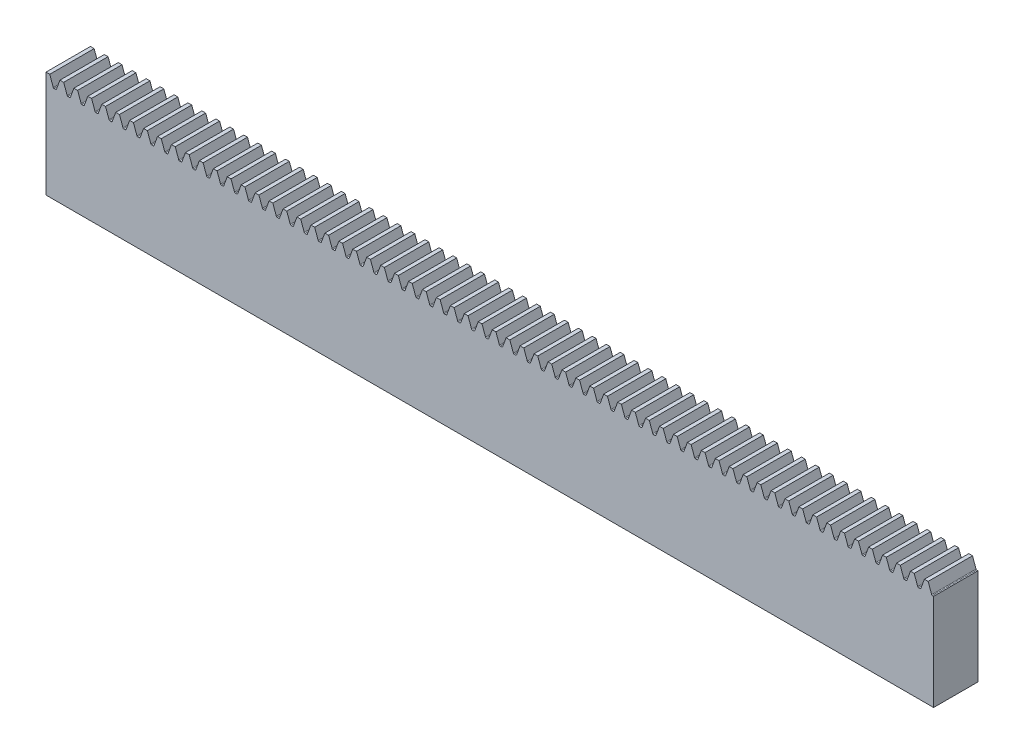
from build123d import *

# Parameters (mm, degrees)
BOSS_EXTRUDE1_DEPTH      = 50
BOSS_EXTRUDE1_DEPTH_BACK = 50
SKETCH2_W                = 5
SKETCH2_H                = 12
TOOTH_CUT_DEPTH          = 52.480578862
FILLET1_R                = 0.093496903
LPATTERN1_START          = -2.5
LPATTERN1_DEPTH          = 5


# Read off the part's stored shape, not the designer's step: LPattern1
with BuildPart() as part:
    # Sketch2 → Boss-Extrude1 (new, two sides: drawn at the far end of the back side and taken through both)
    with BuildSketch(Plane(origin=(0, 0, 0), x_dir=(0, 0, -1), z_dir=(1, 0, 0)).offset(-BOSS_EXTRUDE1_DEPTH_BACK)):
        with Locations((0, 6)):
            Rectangle(SKETCH2_W, SKETCH2_H)
    extrude(amount=BOSS_EXTRUDE1_DEPTH + BOSS_EXTRUDE1_DEPTH_BACK)

    # Tooth Cut Sketch → Tooth Cut (cut, symmetric)
    with BuildSketch(Plane.XY):
        Polygon((-49.578570234, 12), (-49.159713289, 10.8492), (-48.848056946, 10.8492), (-48.4292, 12), align=None)
    extrude(amount=TOOTH_CUT_DEPTH, both=True, mode=Mode.SUBTRACT)

    # Fillet1
    fillet1_edges = [part.edges().sort_by_distance(p)[0] for p in [
        (-48.848056946, 10.8492, 0),
        (-49.159713289, 10.8492, 0),
    ]]
    fillet(fillet1_edges, radius=FILLET1_R)

    # LPattern1 outline → LPattern1 (cut)
    with BuildSketch(Plane.XY.offset(LPATTERN1_START)):
        with BuildLine():
            ThreePointArc((-47.611304402, 10.910719079), (-47.577073673, 10.866108724), (-47.523446052, 10.8492))
            Line((-47.523446052, 10.8492), (-47.342724182, 10.8492))
            ThreePointArc((-47.342724182, 10.8492), (-47.289096561, 10.866108724), (-47.254865832, 10.910719079))
            Line((-47.254865832, 10.910719079), (-46.8584, 12))
            Line((-46.8584, 12), (-48.007770234, 12))
            Line((-48.007770234, 12), (-47.611304402, 10.910719079))
        make_face()
        with BuildLine():
            Line((50, 12), (49.381829766, 12))
            Line((49.381829766, 12), (49.778295598, 10.910719079))
            ThreePointArc((49.778295598, 10.910719079), (49.812526327, 10.866108724), (49.866153948, 10.8492))
            Line((49.866153948, 10.8492), (50, 10.8492))
            Line((50, 10.8492), (50, 12))
        make_face()
        with BuildLine():
            Line((48.9604, 12), (47.811029766, 12))
            Line((47.811029766, 12), (48.207495598, 10.910719079))
            ThreePointArc((48.207495598, 10.910719079), (48.241726327, 10.866108724), (48.295353948, 10.8492))
            Line((48.295353948, 10.8492), (48.476075818, 10.8492))
            ThreePointArc((48.476075818, 10.8492), (48.529703439, 10.866108724), (48.563934168, 10.910719079))
            Line((48.563934168, 10.910719079), (48.9604, 12))
        make_face()
        with BuildLine():
            Line((47.3896, 12), (46.240229766, 12))
            Line((46.240229766, 12), (46.636695598, 10.910719079))
            ThreePointArc((46.636695598, 10.910719079), (46.670926327, 10.866108724), (46.724553948, 10.8492))
            Line((46.724553948, 10.8492), (46.905275818, 10.8492))
            ThreePointArc((46.905275818, 10.8492), (46.958903439, 10.866108724), (46.993134168, 10.910719079))
            Line((46.993134168, 10.910719079), (47.3896, 12))
        make_face()
        with BuildLine():
            Line((45.8188, 12), (44.669429766, 12))
            Line((44.669429766, 12), (45.065895598, 10.910719079))
            ThreePointArc((45.065895598, 10.910719079), (45.100126327, 10.866108724), (45.153753948, 10.8492))
            Line((45.153753948, 10.8492), (45.334475818, 10.8492))
            ThreePointArc((45.334475818, 10.8492), (45.388103439, 10.866108724), (45.422334168, 10.910719079))
            Line((45.422334168, 10.910719079), (45.8188, 12))
        make_face()
        with BuildLine():
            Line((44.248, 12), (43.098629766, 12))
            Line((43.098629766, 12), (43.495095598, 10.910719079))
            ThreePointArc((43.495095598, 10.910719079), (43.529326327, 10.866108724), (43.582953948, 10.8492))
            Line((43.582953948, 10.8492), (43.763675818, 10.8492))
            ThreePointArc((43.763675818, 10.8492), (43.817303439, 10.866108724), (43.851534168, 10.910719079))
            Line((43.851534168, 10.910719079), (44.248, 12))
        make_face()
        with BuildLine():
            Line((42.6772, 12), (41.527829766, 12))
            Line((41.527829766, 12), (41.924295598, 10.910719079))
            ThreePointArc((41.924295598, 10.910719079), (41.958526327, 10.866108724), (42.012153948, 10.8492))
            Line((42.012153948, 10.8492), (42.192875818, 10.8492))
            ThreePointArc((42.192875818, 10.8492), (42.246503439, 10.866108724), (42.280734168, 10.910719079))
            Line((42.280734168, 10.910719079), (42.6772, 12))
        make_face()
        with BuildLine():
            Line((41.1064, 12), (39.957029766, 12))
            Line((39.957029766, 12), (40.353495598, 10.910719079))
            ThreePointArc((40.353495598, 10.910719079), (40.387726327, 10.866108724), (40.441353948, 10.8492))
            Line((40.441353948, 10.8492), (40.622075818, 10.8492))
            ThreePointArc((40.622075818, 10.8492), (40.675703439, 10.866108724), (40.709934168, 10.910719079))
            Line((40.709934168, 10.910719079), (41.1064, 12))
        make_face()
        with BuildLine():
            Line((39.5356, 12), (38.386229766, 12))
            Line((38.386229766, 12), (38.782695598, 10.910719079))
            ThreePointArc((38.782695598, 10.910719079), (38.816926327, 10.866108724), (38.870553948, 10.8492))
            Line((38.870553948, 10.8492), (39.051275818, 10.8492))
            ThreePointArc((39.051275818, 10.8492), (39.104903439, 10.866108724), (39.139134168, 10.910719079))
            Line((39.139134168, 10.910719079), (39.5356, 12))
        make_face()
        with BuildLine():
            Line((37.9648, 12), (36.815429766, 12))
            Line((36.815429766, 12), (37.211895598, 10.910719079))
            ThreePointArc((37.211895598, 10.910719079), (37.246126327, 10.866108724), (37.299753948, 10.8492))
            Line((37.299753948, 10.8492), (37.480475818, 10.8492))
            ThreePointArc((37.480475818, 10.8492), (37.534103439, 10.866108724), (37.568334168, 10.910719079))
            Line((37.568334168, 10.910719079), (37.9648, 12))
        make_face()
        with BuildLine():
            Line((36.394, 12), (35.244629766, 12))
            Line((35.244629766, 12), (35.641095598, 10.910719079))
            ThreePointArc((35.641095598, 10.910719079), (35.675326327, 10.866108724), (35.728953948, 10.8492))
            Line((35.728953948, 10.8492), (35.909675818, 10.8492))
            ThreePointArc((35.909675818, 10.8492), (35.963303439, 10.866108724), (35.997534168, 10.910719079))
            Line((35.997534168, 10.910719079), (36.394, 12))
        make_face()
        with BuildLine():
            Line((34.8232, 12), (33.673829766, 12))
            Line((33.673829766, 12), (34.070295598, 10.910719079))
            ThreePointArc((34.070295598, 10.910719079), (34.104526327, 10.866108724), (34.158153948, 10.8492))
            Line((34.158153948, 10.8492), (34.338875818, 10.8492))
            ThreePointArc((34.338875818, 10.8492), (34.392503439, 10.866108724), (34.426734168, 10.910719079))
            Line((34.426734168, 10.910719079), (34.8232, 12))
        make_face()
        with BuildLine():
            Line((33.2524, 12), (32.103029766, 12))
            Line((32.103029766, 12), (32.499495598, 10.910719079))
            ThreePointArc((32.499495598, 10.910719079), (32.533726327, 10.866108724), (32.587353948, 10.8492))
            Line((32.587353948, 10.8492), (32.768075818, 10.8492))
            ThreePointArc((32.768075818, 10.8492), (32.821703439, 10.866108724), (32.855934168, 10.910719079))
            Line((32.855934168, 10.910719079), (33.2524, 12))
        make_face()
        with BuildLine():
            Line((31.6816, 12), (30.532229766, 12))
            Line((30.532229766, 12), (30.928695598, 10.910719079))
            ThreePointArc((30.928695598, 10.910719079), (30.962926327, 10.866108724), (31.016553948, 10.8492))
            Line((31.016553948, 10.8492), (31.197275818, 10.8492))
            ThreePointArc((31.197275818, 10.8492), (31.250903439, 10.866108724), (31.285134168, 10.910719079))
            Line((31.285134168, 10.910719079), (31.6816, 12))
        make_face()
        with BuildLine():
            Line((30.1108, 12), (28.961429766, 12))
            Line((28.961429766, 12), (29.357895598, 10.910719079))
            ThreePointArc((29.357895598, 10.910719079), (29.392126327, 10.866108724), (29.445753948, 10.8492))
            Line((29.445753948, 10.8492), (29.626475818, 10.8492))
            ThreePointArc((29.626475818, 10.8492), (29.680103439, 10.866108724), (29.714334168, 10.910719079))
            Line((29.714334168, 10.910719079), (30.1108, 12))
        make_face()
        with BuildLine():
            Line((28.54, 12), (27.390629766, 12))
            Line((27.390629766, 12), (27.787095598, 10.910719079))
            ThreePointArc((27.787095598, 10.910719079), (27.821326327, 10.866108724), (27.874953948, 10.8492))
            Line((27.874953948, 10.8492), (28.055675818, 10.8492))
            ThreePointArc((28.055675818, 10.8492), (28.109303439, 10.866108724), (28.143534168, 10.910719079))
            Line((28.143534168, 10.910719079), (28.54, 12))
        make_face()
        with BuildLine():
            Line((26.9692, 12), (25.819829766, 12))
            Line((25.819829766, 12), (26.216295598, 10.910719079))
            ThreePointArc((26.216295598, 10.910719079), (26.250526327, 10.866108724), (26.304153948, 10.8492))
            Line((26.304153948, 10.8492), (26.484875818, 10.8492))
            ThreePointArc((26.484875818, 10.8492), (26.538503439, 10.866108724), (26.572734168, 10.910719079))
            Line((26.572734168, 10.910719079), (26.9692, 12))
        make_face()
        with BuildLine():
            Line((25.3984, 12), (24.249029766, 12))
            Line((24.249029766, 12), (24.645495598, 10.910719079))
            ThreePointArc((24.645495598, 10.910719079), (24.679726327, 10.866108724), (24.733353948, 10.8492))
            Line((24.733353948, 10.8492), (24.914075818, 10.8492))
            ThreePointArc((24.914075818, 10.8492), (24.967703439, 10.866108724), (25.001934168, 10.910719079))
            Line((25.001934168, 10.910719079), (25.3984, 12))
        make_face()
        with BuildLine():
            Line((23.8276, 12), (22.678229766, 12))
            Line((22.678229766, 12), (23.074695598, 10.910719079))
            ThreePointArc((23.074695598, 10.910719079), (23.108926327, 10.866108724), (23.162553948, 10.8492))
            Line((23.162553948, 10.8492), (23.343275818, 10.8492))
            ThreePointArc((23.343275818, 10.8492), (23.396903439, 10.866108724), (23.431134168, 10.910719079))
            Line((23.431134168, 10.910719079), (23.8276, 12))
        make_face()
        with BuildLine():
            Line((22.2568, 12), (21.107429766, 12))
            Line((21.107429766, 12), (21.503895598, 10.910719079))
            ThreePointArc((21.503895598, 10.910719079), (21.538126327, 10.866108724), (21.591753948, 10.8492))
            Line((21.591753948, 10.8492), (21.772475818, 10.8492))
            ThreePointArc((21.772475818, 10.8492), (21.826103439, 10.866108724), (21.860334168, 10.910719079))
            Line((21.860334168, 10.910719079), (22.2568, 12))
        make_face()
        with BuildLine():
            Line((20.686, 12), (19.536629766, 12))
            Line((19.536629766, 12), (19.933095598, 10.910719079))
            ThreePointArc((19.933095598, 10.910719079), (19.967326327, 10.866108724), (20.020953948, 10.8492))
            Line((20.020953948, 10.8492), (20.201675818, 10.8492))
            ThreePointArc((20.201675818, 10.8492), (20.255303439, 10.866108724), (20.289534168, 10.910719079))
            Line((20.289534168, 10.910719079), (20.686, 12))
        make_face()
        with BuildLine():
            Line((19.1152, 12), (17.965829766, 12))
            Line((17.965829766, 12), (18.362295598, 10.910719079))
            ThreePointArc((18.362295598, 10.910719079), (18.396526327, 10.866108724), (18.450153948, 10.8492))
            Line((18.450153948, 10.8492), (18.630875818, 10.8492))
            ThreePointArc((18.630875818, 10.8492), (18.684503439, 10.866108724), (18.718734168, 10.910719079))
            Line((18.718734168, 10.910719079), (19.1152, 12))
        make_face()
        with BuildLine():
            Line((17.5444, 12), (16.395029766, 12))
            Line((16.395029766, 12), (16.791495598, 10.910719079))
            ThreePointArc((16.791495598, 10.910719079), (16.825726327, 10.866108724), (16.879353948, 10.8492))
            Line((16.879353948, 10.8492), (17.060075818, 10.8492))
            ThreePointArc((17.060075818, 10.8492), (17.113703439, 10.866108724), (17.147934168, 10.910719079))
            Line((17.147934168, 10.910719079), (17.5444, 12))
        make_face()
        with BuildLine():
            Line((15.9736, 12), (14.824229766, 12))
            Line((14.824229766, 12), (15.220695598, 10.910719079))
            ThreePointArc((15.220695598, 10.910719079), (15.254926327, 10.866108724), (15.308553948, 10.8492))
            Line((15.308553948, 10.8492), (15.489275818, 10.8492))
            ThreePointArc((15.489275818, 10.8492), (15.542903439, 10.866108724), (15.577134168, 10.910719079))
            Line((15.577134168, 10.910719079), (15.9736, 12))
        make_face()
        with BuildLine():
            Line((14.4028, 12), (13.253429766, 12))
            Line((13.253429766, 12), (13.649895598, 10.910719079))
            ThreePointArc((13.649895598, 10.910719079), (13.684126327, 10.866108724), (13.737753948, 10.8492))
            Line((13.737753948, 10.8492), (13.918475818, 10.8492))
            ThreePointArc((13.918475818, 10.8492), (13.972103439, 10.866108724), (14.006334168, 10.910719079))
            Line((14.006334168, 10.910719079), (14.4028, 12))
        make_face()
        with BuildLine():
            Line((12.832, 12), (11.682629766, 12))
            Line((11.682629766, 12), (12.079095598, 10.910719079))
            ThreePointArc((12.079095598, 10.910719079), (12.113326327, 10.866108724), (12.166953948, 10.8492))
            Line((12.166953948, 10.8492), (12.347675818, 10.8492))
            ThreePointArc((12.347675818, 10.8492), (12.401303439, 10.866108724), (12.435534168, 10.910719079))
            Line((12.435534168, 10.910719079), (12.832, 12))
        make_face()
        with BuildLine():
            Line((11.2612, 12), (10.111829766, 12))
            Line((10.111829766, 12), (10.508295598, 10.910719079))
            ThreePointArc((10.508295598, 10.910719079), (10.542526327, 10.866108724), (10.596153948, 10.8492))
            Line((10.596153948, 10.8492), (10.776875818, 10.8492))
            ThreePointArc((10.776875818, 10.8492), (10.830503439, 10.866108724), (10.864734168, 10.910719079))
            Line((10.864734168, 10.910719079), (11.2612, 12))
        make_face()
        with BuildLine():
            Line((9.6904, 12), (8.541029766, 12))
            Line((8.541029766, 12), (8.937495598, 10.910719079))
            ThreePointArc((8.937495598, 10.910719079), (8.971726327, 10.866108724), (9.025353948, 10.8492))
            Line((9.025353948, 10.8492), (9.206075818, 10.8492))
            ThreePointArc((9.206075818, 10.8492), (9.259703439, 10.866108724), (9.293934168, 10.910719079))
            Line((9.293934168, 10.910719079), (9.6904, 12))
        make_face()
        with BuildLine():
            Line((8.1196, 12), (6.970229766, 12))
            Line((6.970229766, 12), (7.366695598, 10.910719079))
            ThreePointArc((7.366695598, 10.910719079), (7.400926327, 10.866108724), (7.454553948, 10.8492))
            Line((7.454553948, 10.8492), (7.635275818, 10.8492))
            ThreePointArc((7.635275818, 10.8492), (7.688903439, 10.866108724), (7.723134168, 10.910719079))
            Line((7.723134168, 10.910719079), (8.1196, 12))
        make_face()
        with BuildLine():
            Line((6.5488, 12), (5.399429766, 12))
            Line((5.399429766, 12), (5.795895598, 10.910719079))
            ThreePointArc((5.795895598, 10.910719079), (5.830126327, 10.866108724), (5.883753948, 10.8492))
            Line((5.883753948, 10.8492), (6.064475818, 10.8492))
            ThreePointArc((6.064475818, 10.8492), (6.118103439, 10.866108724), (6.152334168, 10.910719079))
            Line((6.152334168, 10.910719079), (6.5488, 12))
        make_face()
        with BuildLine():
            Line((4.978, 12), (3.828629766, 12))
            Line((3.828629766, 12), (4.225095598, 10.910719079))
            ThreePointArc((4.225095598, 10.910719079), (4.259326327, 10.866108724), (4.312953948, 10.8492))
            Line((4.312953948, 10.8492), (4.493675818, 10.8492))
            ThreePointArc((4.493675818, 10.8492), (4.547303439, 10.866108724), (4.581534168, 10.910719079))
            Line((4.581534168, 10.910719079), (4.978, 12))
        make_face()
        with BuildLine():
            Line((3.4072, 12), (2.257829766, 12))
            Line((2.257829766, 12), (2.654295598, 10.910719079))
            ThreePointArc((2.654295598, 10.910719079), (2.688526327, 10.866108724), (2.742153948, 10.8492))
            Line((2.742153948, 10.8492), (2.922875818, 10.8492))
            ThreePointArc((2.922875818, 10.8492), (2.976503439, 10.866108724), (3.010734168, 10.910719079))
            Line((3.010734168, 10.910719079), (3.4072, 12))
        make_face()
        with BuildLine():
            Line((1.8364, 12), (0.687029766, 12))
            Line((0.687029766, 12), (1.083495598, 10.910719079))
            ThreePointArc((1.083495598, 10.910719079), (1.117726327, 10.866108724), (1.171353948, 10.8492))
            Line((1.171353948, 10.8492), (1.352075818, 10.8492))
            ThreePointArc((1.352075818, 10.8492), (1.405703439, 10.866108724), (1.439934168, 10.910719079))
            Line((1.439934168, 10.910719079), (1.8364, 12))
        make_face()
        with BuildLine():
            Line((0.2656, 12), (-0.883770234, 12))
            Line((-0.883770234, 12), (-0.487304402, 10.910719079))
            ThreePointArc((-0.487304402, 10.910719079), (-0.453073673, 10.866108724), (-0.399446052, 10.8492))
            Line((-0.399446052, 10.8492), (-0.218724182, 10.8492))
            ThreePointArc((-0.218724182, 10.8492), (-0.165096561, 10.866108724), (-0.130865832, 10.910719079))
            Line((-0.130865832, 10.910719079), (0.2656, 12))
        make_face()
        with BuildLine():
            Line((-1.3052, 12), (-2.454570234, 12))
            Line((-2.454570234, 12), (-2.058104402, 10.910719079))
            ThreePointArc((-2.058104402, 10.910719079), (-2.023873673, 10.866108724), (-1.970246052, 10.8492))
            Line((-1.970246052, 10.8492), (-1.789524182, 10.8492))
            ThreePointArc((-1.789524182, 10.8492), (-1.735896561, 10.866108724), (-1.701665832, 10.910719079))
            Line((-1.701665832, 10.910719079), (-1.3052, 12))
        make_face()
        with BuildLine():
            Line((-2.876, 12), (-4.025370234, 12))
            Line((-4.025370234, 12), (-3.628904402, 10.910719079))
            ThreePointArc((-3.628904402, 10.910719079), (-3.594673673, 10.866108724), (-3.541046052, 10.8492))
            Line((-3.541046052, 10.8492), (-3.360324182, 10.8492))
            ThreePointArc((-3.360324182, 10.8492), (-3.306696561, 10.866108724), (-3.272465832, 10.910719079))
            Line((-3.272465832, 10.910719079), (-2.876, 12))
        make_face()
        with BuildLine():
            Line((-4.4468, 12), (-5.596170234, 12))
            Line((-5.596170234, 12), (-5.199704402, 10.910719079))
            ThreePointArc((-5.199704402, 10.910719079), (-5.165473673, 10.866108724), (-5.111846052, 10.8492))
            Line((-5.111846052, 10.8492), (-4.931124182, 10.8492))
            ThreePointArc((-4.931124182, 10.8492), (-4.877496561, 10.866108724), (-4.843265832, 10.910719079))
            Line((-4.843265832, 10.910719079), (-4.4468, 12))
        make_face()
        with BuildLine():
            Line((-6.0176, 12), (-7.166970234, 12))
            Line((-7.166970234, 12), (-6.770504402, 10.910719079))
            ThreePointArc((-6.770504402, 10.910719079), (-6.736273673, 10.866108724), (-6.682646052, 10.8492))
            Line((-6.682646052, 10.8492), (-6.501924182, 10.8492))
            ThreePointArc((-6.501924182, 10.8492), (-6.448296561, 10.866108724), (-6.414065832, 10.910719079))
            Line((-6.414065832, 10.910719079), (-6.0176, 12))
        make_face()
        with BuildLine():
            Line((-7.5884, 12), (-8.737770234, 12))
            Line((-8.737770234, 12), (-8.341304402, 10.910719079))
            ThreePointArc((-8.341304402, 10.910719079), (-8.307073673, 10.866108724), (-8.253446052, 10.8492))
            Line((-8.253446052, 10.8492), (-8.072724182, 10.8492))
            ThreePointArc((-8.072724182, 10.8492), (-8.019096561, 10.866108724), (-7.984865832, 10.910719079))
            Line((-7.984865832, 10.910719079), (-7.5884, 12))
        make_face()
        with BuildLine():
            Line((-9.1592, 12), (-10.308570234, 12))
            Line((-10.308570234, 12), (-9.912104402, 10.910719079))
            ThreePointArc((-9.912104402, 10.910719079), (-9.877873673, 10.866108724), (-9.824246052, 10.8492))
            Line((-9.824246052, 10.8492), (-9.643524182, 10.8492))
            ThreePointArc((-9.643524182, 10.8492), (-9.589896561, 10.866108724), (-9.555665832, 10.910719079))
            Line((-9.555665832, 10.910719079), (-9.1592, 12))
        make_face()
        with BuildLine():
            Line((-10.73, 12), (-11.879370234, 12))
            Line((-11.879370234, 12), (-11.482904402, 10.910719079))
            ThreePointArc((-11.482904402, 10.910719079), (-11.448673673, 10.866108724), (-11.395046052, 10.8492))
            Line((-11.395046052, 10.8492), (-11.214324182, 10.8492))
            ThreePointArc((-11.214324182, 10.8492), (-11.160696561, 10.866108724), (-11.126465832, 10.910719079))
            Line((-11.126465832, 10.910719079), (-10.73, 12))
        make_face()
        with BuildLine():
            Line((-12.3008, 12), (-13.450170234, 12))
            Line((-13.450170234, 12), (-13.053704402, 10.910719079))
            ThreePointArc((-13.053704402, 10.910719079), (-13.019473673, 10.866108724), (-12.965846052, 10.8492))
            Line((-12.965846052, 10.8492), (-12.785124182, 10.8492))
            ThreePointArc((-12.785124182, 10.8492), (-12.731496561, 10.866108724), (-12.697265832, 10.910719079))
            Line((-12.697265832, 10.910719079), (-12.3008, 12))
        make_face()
        with BuildLine():
            Line((-13.8716, 12), (-15.020970234, 12))
            Line((-15.020970234, 12), (-14.624504402, 10.910719079))
            ThreePointArc((-14.624504402, 10.910719079), (-14.590273673, 10.866108724), (-14.536646052, 10.8492))
            Line((-14.536646052, 10.8492), (-14.355924182, 10.8492))
            ThreePointArc((-14.355924182, 10.8492), (-14.302296561, 10.866108724), (-14.268065832, 10.910719079))
            Line((-14.268065832, 10.910719079), (-13.8716, 12))
        make_face()
        with BuildLine():
            Line((-15.4424, 12), (-16.591770234, 12))
            Line((-16.591770234, 12), (-16.195304402, 10.910719079))
            ThreePointArc((-16.195304402, 10.910719079), (-16.161073673, 10.866108724), (-16.107446052, 10.8492))
            Line((-16.107446052, 10.8492), (-15.926724182, 10.8492))
            ThreePointArc((-15.926724182, 10.8492), (-15.873096561, 10.866108724), (-15.838865832, 10.910719079))
            Line((-15.838865832, 10.910719079), (-15.4424, 12))
        make_face()
        with BuildLine():
            Line((-17.0132, 12), (-18.162570234, 12))
            Line((-18.162570234, 12), (-17.766104402, 10.910719079))
            ThreePointArc((-17.766104402, 10.910719079), (-17.731873673, 10.866108724), (-17.678246052, 10.8492))
            Line((-17.678246052, 10.8492), (-17.497524182, 10.8492))
            ThreePointArc((-17.497524182, 10.8492), (-17.443896561, 10.866108724), (-17.409665832, 10.910719079))
            Line((-17.409665832, 10.910719079), (-17.0132, 12))
        make_face()
        with BuildLine():
            Line((-18.584, 12), (-19.733370234, 12))
            Line((-19.733370234, 12), (-19.336904402, 10.910719079))
            ThreePointArc((-19.336904402, 10.910719079), (-19.302673673, 10.866108724), (-19.249046052, 10.8492))
            Line((-19.249046052, 10.8492), (-19.068324182, 10.8492))
            ThreePointArc((-19.068324182, 10.8492), (-19.014696561, 10.866108724), (-18.980465832, 10.910719079))
            Line((-18.980465832, 10.910719079), (-18.584, 12))
        make_face()
        with BuildLine():
            Line((-20.1548, 12), (-21.304170234, 12))
            Line((-21.304170234, 12), (-20.907704402, 10.910719079))
            ThreePointArc((-20.907704402, 10.910719079), (-20.873473673, 10.866108724), (-20.819846052, 10.8492))
            Line((-20.819846052, 10.8492), (-20.639124182, 10.8492))
            ThreePointArc((-20.639124182, 10.8492), (-20.585496561, 10.866108724), (-20.551265832, 10.910719079))
            Line((-20.551265832, 10.910719079), (-20.1548, 12))
        make_face()
        with BuildLine():
            Line((-21.7256, 12), (-22.874970234, 12))
            Line((-22.874970234, 12), (-22.478504402, 10.910719079))
            ThreePointArc((-22.478504402, 10.910719079), (-22.444273673, 10.866108724), (-22.390646052, 10.8492))
            Line((-22.390646052, 10.8492), (-22.209924182, 10.8492))
            ThreePointArc((-22.209924182, 10.8492), (-22.156296561, 10.866108724), (-22.122065832, 10.910719079))
            Line((-22.122065832, 10.910719079), (-21.7256, 12))
        make_face()
        with BuildLine():
            Line((-23.2964, 12), (-24.445770234, 12))
            Line((-24.445770234, 12), (-24.049304402, 10.910719079))
            ThreePointArc((-24.049304402, 10.910719079), (-24.015073673, 10.866108724), (-23.961446052, 10.8492))
            Line((-23.961446052, 10.8492), (-23.780724182, 10.8492))
            ThreePointArc((-23.780724182, 10.8492), (-23.727096561, 10.866108724), (-23.692865832, 10.910719079))
            Line((-23.692865832, 10.910719079), (-23.2964, 12))
        make_face()
        with BuildLine():
            Line((-24.8672, 12), (-26.016570234, 12))
            Line((-26.016570234, 12), (-25.620104402, 10.910719079))
            ThreePointArc((-25.620104402, 10.910719079), (-25.585873673, 10.866108724), (-25.532246052, 10.8492))
            Line((-25.532246052, 10.8492), (-25.351524182, 10.8492))
            ThreePointArc((-25.351524182, 10.8492), (-25.297896561, 10.866108724), (-25.263665832, 10.910719079))
            Line((-25.263665832, 10.910719079), (-24.8672, 12))
        make_face()
        with BuildLine():
            Line((-26.438, 12), (-27.587370234, 12))
            Line((-27.587370234, 12), (-27.190904402, 10.910719079))
            ThreePointArc((-27.190904402, 10.910719079), (-27.156673673, 10.866108724), (-27.103046052, 10.8492))
            Line((-27.103046052, 10.8492), (-26.922324182, 10.8492))
            ThreePointArc((-26.922324182, 10.8492), (-26.868696561, 10.866108724), (-26.834465832, 10.910719079))
            Line((-26.834465832, 10.910719079), (-26.438, 12))
        make_face()
        with BuildLine():
            Line((-28.0088, 12), (-29.158170234, 12))
            Line((-29.158170234, 12), (-28.761704402, 10.910719079))
            ThreePointArc((-28.761704402, 10.910719079), (-28.727473673, 10.866108724), (-28.673846052, 10.8492))
            Line((-28.673846052, 10.8492), (-28.493124182, 10.8492))
            ThreePointArc((-28.493124182, 10.8492), (-28.439496561, 10.866108724), (-28.405265832, 10.910719079))
            Line((-28.405265832, 10.910719079), (-28.0088, 12))
        make_face()
        with BuildLine():
            Line((-29.5796, 12), (-30.728970234, 12))
            Line((-30.728970234, 12), (-30.332504402, 10.910719079))
            ThreePointArc((-30.332504402, 10.910719079), (-30.298273673, 10.866108724), (-30.244646052, 10.8492))
            Line((-30.244646052, 10.8492), (-30.063924182, 10.8492))
            ThreePointArc((-30.063924182, 10.8492), (-30.010296561, 10.866108724), (-29.976065832, 10.910719079))
            Line((-29.976065832, 10.910719079), (-29.5796, 12))
        make_face()
        with BuildLine():
            Line((-31.1504, 12), (-32.299770234, 12))
            Line((-32.299770234, 12), (-31.903304402, 10.910719079))
            ThreePointArc((-31.903304402, 10.910719079), (-31.869073673, 10.866108724), (-31.815446052, 10.8492))
            Line((-31.815446052, 10.8492), (-31.634724182, 10.8492))
            ThreePointArc((-31.634724182, 10.8492), (-31.581096561, 10.866108724), (-31.546865832, 10.910719079))
            Line((-31.546865832, 10.910719079), (-31.1504, 12))
        make_face()
        with BuildLine():
            Line((-32.7212, 12), (-33.870570234, 12))
            Line((-33.870570234, 12), (-33.474104402, 10.910719079))
            ThreePointArc((-33.474104402, 10.910719079), (-33.439873673, 10.866108724), (-33.386246052, 10.8492))
            Line((-33.386246052, 10.8492), (-33.205524182, 10.8492))
            ThreePointArc((-33.205524182, 10.8492), (-33.151896561, 10.866108724), (-33.117665832, 10.910719079))
            Line((-33.117665832, 10.910719079), (-32.7212, 12))
        make_face()
        with BuildLine():
            Line((-34.292, 12), (-35.441370234, 12))
            Line((-35.441370234, 12), (-35.044904402, 10.910719079))
            ThreePointArc((-35.044904402, 10.910719079), (-35.010673673, 10.866108724), (-34.957046052, 10.8492))
            Line((-34.957046052, 10.8492), (-34.776324182, 10.8492))
            ThreePointArc((-34.776324182, 10.8492), (-34.722696561, 10.866108724), (-34.688465832, 10.910719079))
            Line((-34.688465832, 10.910719079), (-34.292, 12))
        make_face()
        with BuildLine():
            Line((-35.8628, 12), (-37.012170234, 12))
            Line((-37.012170234, 12), (-36.615704402, 10.910719079))
            ThreePointArc((-36.615704402, 10.910719079), (-36.581473673, 10.866108724), (-36.527846052, 10.8492))
            Line((-36.527846052, 10.8492), (-36.347124182, 10.8492))
            ThreePointArc((-36.347124182, 10.8492), (-36.293496561, 10.866108724), (-36.259265832, 10.910719079))
            Line((-36.259265832, 10.910719079), (-35.8628, 12))
        make_face()
        with BuildLine():
            Line((-37.4336, 12), (-38.582970234, 12))
            Line((-38.582970234, 12), (-38.186504402, 10.910719079))
            ThreePointArc((-38.186504402, 10.910719079), (-38.152273673, 10.866108724), (-38.098646052, 10.8492))
            Line((-38.098646052, 10.8492), (-37.917924182, 10.8492))
            ThreePointArc((-37.917924182, 10.8492), (-37.864296561, 10.866108724), (-37.830065832, 10.910719079))
            Line((-37.830065832, 10.910719079), (-37.4336, 12))
        make_face()
        with BuildLine():
            Line((-39.0044, 12), (-40.153770234, 12))
            Line((-40.153770234, 12), (-39.757304402, 10.910719079))
            ThreePointArc((-39.757304402, 10.910719079), (-39.723073673, 10.866108724), (-39.669446052, 10.8492))
            Line((-39.669446052, 10.8492), (-39.488724182, 10.8492))
            ThreePointArc((-39.488724182, 10.8492), (-39.435096561, 10.866108724), (-39.400865832, 10.910719079))
            Line((-39.400865832, 10.910719079), (-39.0044, 12))
        make_face()
        with BuildLine():
            Line((-40.5752, 12), (-41.724570234, 12))
            Line((-41.724570234, 12), (-41.328104402, 10.910719079))
            ThreePointArc((-41.328104402, 10.910719079), (-41.293873673, 10.866108724), (-41.240246052, 10.8492))
            Line((-41.240246052, 10.8492), (-41.059524182, 10.8492))
            ThreePointArc((-41.059524182, 10.8492), (-41.005896561, 10.866108724), (-40.971665832, 10.910719079))
            Line((-40.971665832, 10.910719079), (-40.5752, 12))
        make_face()
        with BuildLine():
            Line((-42.146, 12), (-43.295370234, 12))
            Line((-43.295370234, 12), (-42.898904402, 10.910719079))
            ThreePointArc((-42.898904402, 10.910719079), (-42.864673673, 10.866108724), (-42.811046052, 10.8492))
            Line((-42.811046052, 10.8492), (-42.630324182, 10.8492))
            ThreePointArc((-42.630324182, 10.8492), (-42.576696561, 10.866108724), (-42.542465832, 10.910719079))
            Line((-42.542465832, 10.910719079), (-42.146, 12))
        make_face()
        with BuildLine():
            Line((-43.7168, 12), (-44.866170234, 12))
            Line((-44.866170234, 12), (-44.469704402, 10.910719079))
            ThreePointArc((-44.469704402, 10.910719079), (-44.435473673, 10.866108724), (-44.381846052, 10.8492))
            Line((-44.381846052, 10.8492), (-44.201124182, 10.8492))
            ThreePointArc((-44.201124182, 10.8492), (-44.147496561, 10.866108724), (-44.113265832, 10.910719079))
            Line((-44.113265832, 10.910719079), (-43.7168, 12))
        make_face()
        with BuildLine():
            Line((-45.2876, 12), (-46.436970234, 12))
            Line((-46.436970234, 12), (-46.040504402, 10.910719079))
            ThreePointArc((-46.040504402, 10.910719079), (-46.006273673, 10.866108724), (-45.952646052, 10.8492))
            Line((-45.952646052, 10.8492), (-45.771924182, 10.8492))
            ThreePointArc((-45.771924182, 10.8492), (-45.718296561, 10.866108724), (-45.684065832, 10.910719079))
            Line((-45.684065832, 10.910719079), (-45.2876, 12))
        make_face()
    extrude(amount=LPATTERN1_DEPTH, mode=Mode.SUBTRACT)


solid = part.part
